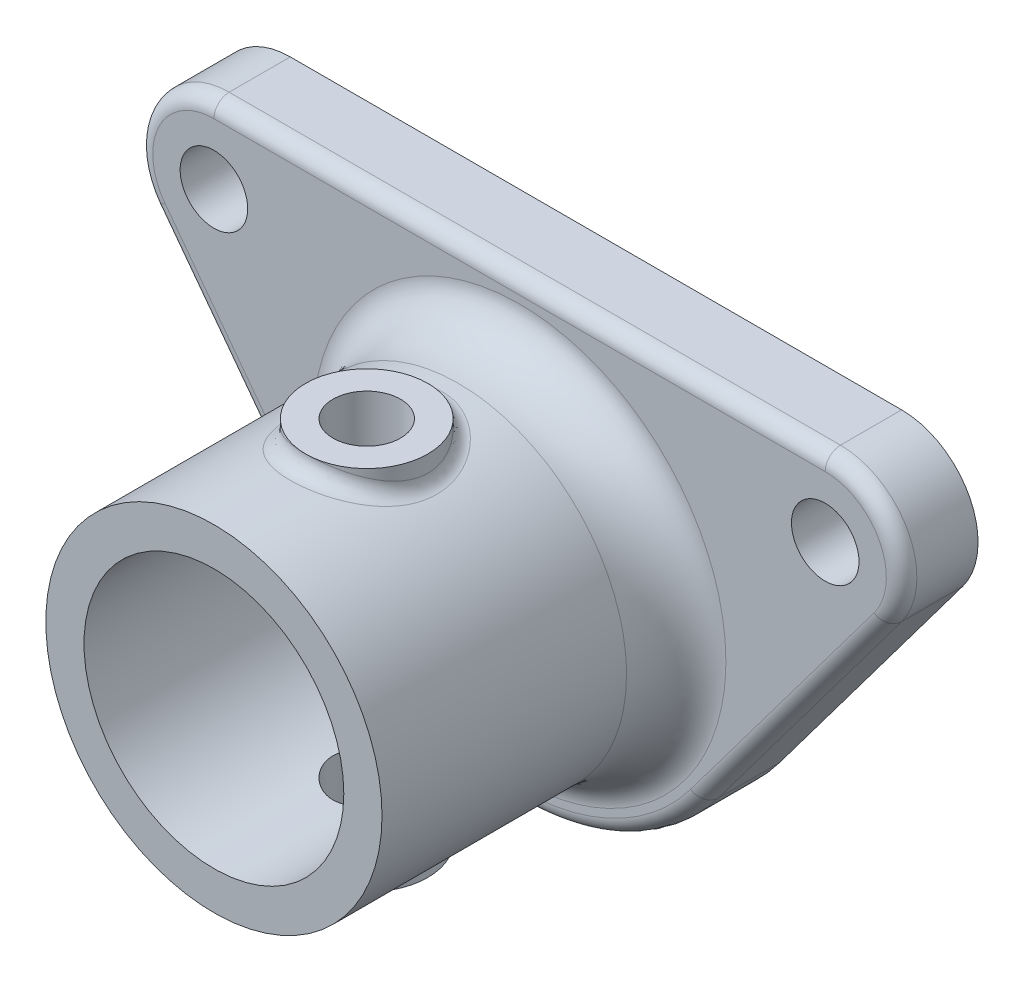
from build123d import *

# Parameters (mm, degrees)
BOSS_EXTRUDE1_DEPTH    = 6.35
SKETCH2_R              = 13.97
BOSS_EXTRUDE2_DEPTH    = 25.4
F_10_CLEARANCE_HOLE1_D = 5.6134
FILLET2_SIZE           = 3.175
FILLET2_SIZE_2         = 5.08
FILLET3_R              = 1.27
SKETCH7_R              = 5.08
BOSS_EXTRUDE3_DEPTH    = 15.24
FILLET4_R              = 1.27
SKETCH8_R              = 10.795
CUT_EXTRUDE1_DEPTH     = 25.4
F_10_CLEARANCE_HOLE2_D = 5.6134


with BuildPart() as part:
    # Sketch1 → Boss-Extrude1 (new body)
    with BuildSketch(Plane.XY):
        with BuildLine():
            Line((15.24, -11.43), (30.48, 8.89))
            ThreePointArc((30.48, 8.89), (31.079612663, 15.539806331), (25.4, 19.05))
            Line((25.4, 19.05), (0, 19.05))
            Line((0, 19.05), (-25.4, 19.05))
            ThreePointArc((-25.4, 19.05), (-31.079612663, 15.539806331), (-30.48, 8.89))
            Line((-30.48, 8.89), (-15.24, -11.43))
            ThreePointArc((-15.24, -11.43), (0, -19.05), (15.24, -11.43))
        make_face()
    extrude(amount=BOSS_EXTRUDE1_DEPTH)

    # Sketch2 → Boss-Extrude2 (add)
    with BuildSketch(Plane.XY.offset(6.35)):
        Circle(SKETCH2_R)
    extrude(amount=BOSS_EXTRUDE2_DEPTH)

    # #10 Clearance Hole1 (through all)
    with Locations(Plane.XY.offset(6.35)):
        with Locations((-25.4, 12.7), (25.4, 12.7)):
            Hole(F_10_CLEARANCE_HOLE1_D / 2)

    # Fillet2
    # an asymmetric fillet: 5.08, 3.175 mm, written as the material it adds along each edge
    with BuildSketch(Plane(origin=(0, 0, 6.35), x_dir=(1, 0, 0), z_dir=(0, -1, 0))) as fillet2_piece_1:
        with BuildLine():
            Bezier((13.97 + FILLET2_SIZE, 0), (13.97, 0), (13.97, FILLET2_SIZE_2), weights=[1, 0.707106781, 1])
            Line((13.97, FILLET2_SIZE_2), (13.97, 0))
            Line((13.97, 0), (13.97 + FILLET2_SIZE, 0))
        make_face()
    revolve(axis=Axis((0, 0, 6.35), (0, 0, 1)))

    # Fillet3
    fillet3_edges = [part.edges().sort_by_distance(p)[0] for p in [
        (31.079612663, 15.539806331, 6.35),
        (0, 19.05, 6.35),
        (-31.079612663, 15.539806331, 6.35),
        (-22.86, -1.27, 6.35),
        (0, -19.05, 6.35),
        (22.86, -1.27, 6.35),
    ]]
    fillet(fillet3_edges, radius=FILLET3_R)

    # Sketch7 → Boss-Extrude3 (add, symmetric)
    with BuildSketch(Plane(origin=(0, 0, 0), x_dir=(1, 0, 0), z_dir=(0, 1, 0))):
        with Locations(Location((0, -19.05, 0), (0, 0, 90))):
            Circle(SKETCH7_R)
    extrude(amount=BOSS_EXTRUDE3_DEPTH, both=True)

    # Fillet4
    fillet4_edges = [part.edges().sort_by_distance(p)[0] for p in [
        (1e-09, -13.97, 24.130000002),
        (1e-09, 13.97, 24.130000002),
    ]]
    fillet(fillet4_edges, radius=FILLET4_R)

    # Sketch8 → Cut-Extrude1 (cut)
    with BuildSketch(Plane.XY.offset(31.75)):
        Circle(SKETCH8_R)
    extrude(amount=-CUT_EXTRUDE1_DEPTH, mode=Mode.SUBTRACT)

    # #10 Clearance Hole2 (through all)
    with Locations(Plane(origin=(0, 15.24, 0), x_dir=(1, 0, 0), z_dir=(0, 1, 0))):
        with Locations((0, -19.05)):
            Hole(F_10_CLEARANCE_HOLE2_D / 2)


solid = part.part
